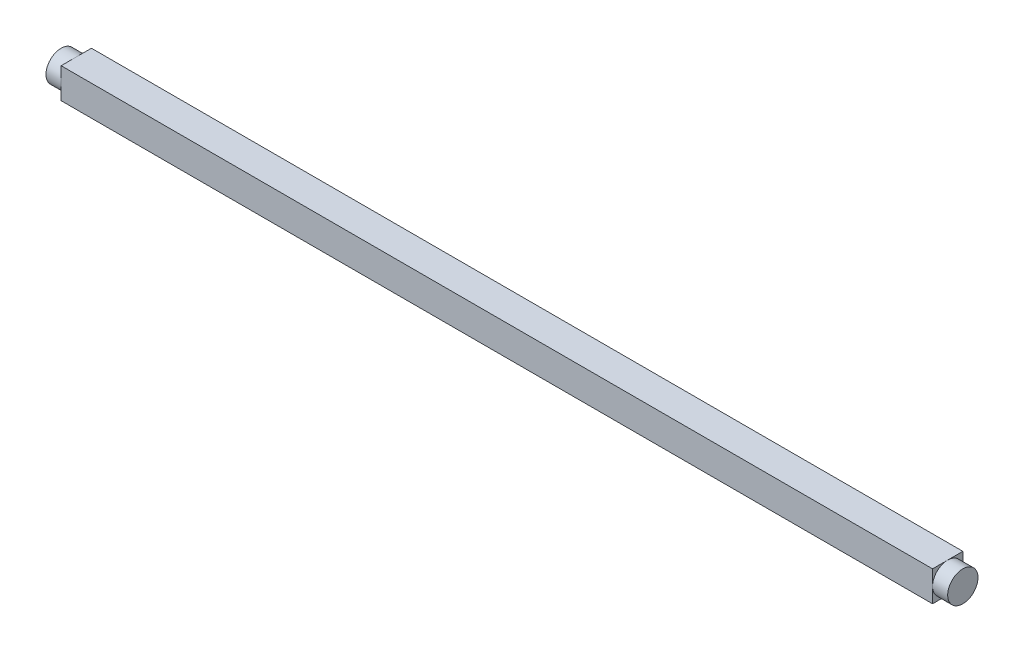
from build123d import *

# Parameters (mm, degrees)
SKETCH1_W           = 6.35
SKETCH1_H           = 6.35
BOSS_EXTRUDE1_DEPTH = 94.45625
SKETCH2_W           = 7.9375
SKETCH2_H           = 7.9375
SKETCH2_R           = 3.175
CUT_EXTRUDE1_DEPTH  = 3.175


with BuildPart() as part:
    # Sketch1 → Boss-Extrude1 (new body)
    with BuildSketch(Plane(origin=(0, 0, 0), x_dir=(0, 0, -1), z_dir=(1, 0, 0))):
        Rectangle(SKETCH1_W, SKETCH1_H)
    extrude(amount=BOSS_EXTRUDE1_DEPTH)

    # Sketch2 → Cut-Extrude1 (cut)
    with BuildSketch(Plane(origin=(94.45625, 0, 0), x_dir=(0, 0, -1), z_dir=(1, 0, 0))):
        Rectangle(SKETCH2_W, SKETCH2_H)
        Circle(SKETCH2_R, mode=Mode.SUBTRACT)
    extrude(amount=-CUT_EXTRUDE1_DEPTH, mode=Mode.SUBTRACT)

    # Mirror1: part across plane


with BuildPart() as part_1:
    add(part.part)
    add(part.part.mirror(Plane(origin=(0, 0, 0), x_dir=(0, 0, 1), z_dir=(1, 0, 0))))


solid = part_1.part
